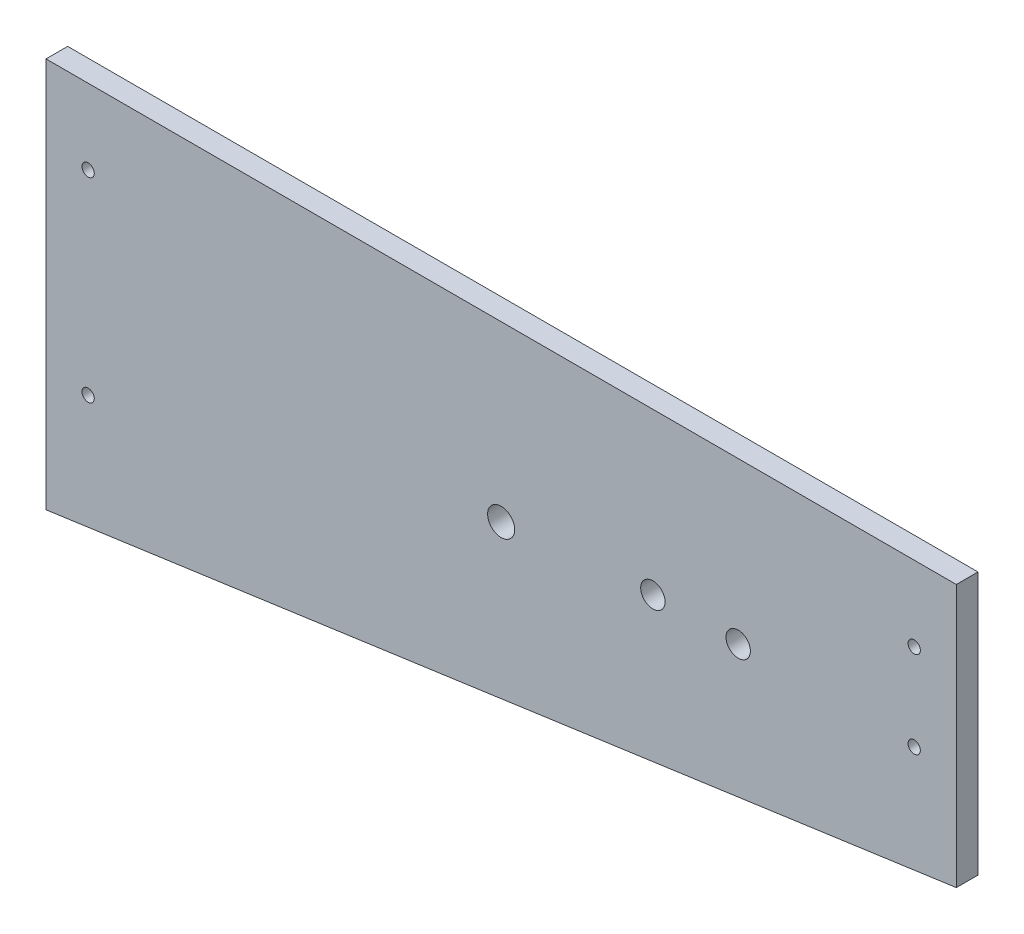
from build123d import *

# Parameters (mm, degrees)
SKETCH1_W               = 266.7
SKETCH1_H               = 114.4016
BOSS_EXTRUDE1_DEPTH     = 6.35
M3_CLEARANCE_HOLE1_D    = 3.6
CUT_EXTRUDE2_DEPTH      = 291.270457647
SKETCH6_R               = 3.96875
DIAPHRAGM_DEPTH         = 291.270457647
F_1_4_CLEARANCE_HOLE1_D = 7.14248


with BuildPart() as part:
    # Sketch1 → Boss-Extrude1 (new body)
    with BuildSketch(Plane.XY):
        with Locations((133.35, 57.2008)):
            Rectangle(SKETCH1_W, SKETCH1_H)
    extrude(amount=BOSS_EXTRUDE1_DEPTH)

    # M3 Clearance Hole1 (through all)
    with Locations(Plane.XY.offset(6.35)):
        with Locations((12.3444, 92.4052), (12.3444, 35.2552), (254.3556, 67.0052), (254.3556, 92.4052)):
            Hole(M3_CLEARANCE_HOLE1_D / 2)

    # Sketch5 → Cut-Extrude2 (cut, through all)
    with BuildSketch(Plane.XY.offset(6.35)):
        Polygon((0, 0), (266.7, 0), (266.7, 37.482240615), align=None)
    extrude(amount=-CUT_EXTRUDE2_DEPTH, mode=Mode.SUBTRACT)

    # Sketch6 → diaphragm (cut, through all)
    with BuildSketch(Plane.XY.offset(6.35)):
        with Locations((133.35, 63.6016)):
            Circle(SKETCH6_R)
    extrude(amount=-DIAPHRAGM_DEPTH, mode=Mode.SUBTRACT)

    # 1/4 Clearance Hole1 (through all)
    with Locations(Plane.XY.offset(6.35)):
        with Locations((177.8, 67.310033974), (202.7936, 67.310033974)):
            Hole(F_1_4_CLEARANCE_HOLE1_D / 2)


solid = part.part
